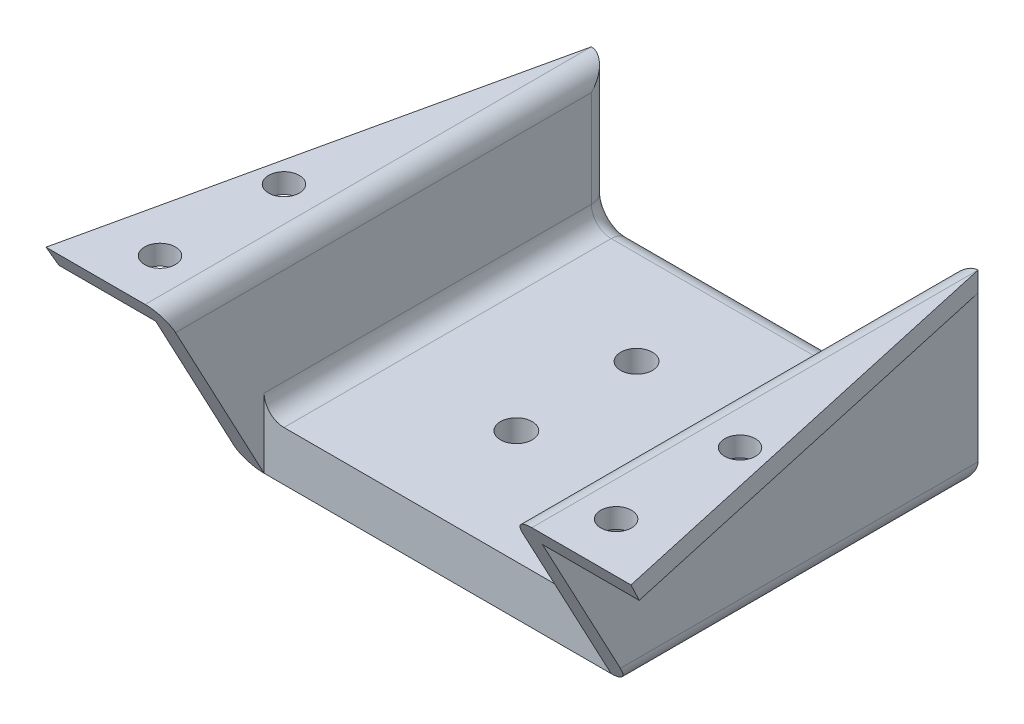
from build123d import *

# Parameters (mm, degrees)
SKETCH2_W           = 35
SKETCH2_H           = 35
SKETCH2_R           = 1.6
BOSS_EXTRUDE1_DEPTH = 5
BOSS_EXTRUDE2_DEPTH = 2
SKETCH4_R           = 1.55
BOSS_EXTRUDE3_DEPTH = 2
CUT_EXTRUDE1_DEPTH  = 52.27194652
FILLET1_R           = 2


with BuildPart() as part:
    # Sketch2 → Boss-Extrude1 (new body)
    with BuildSketch(Plane(origin=(0, 0, 0), x_dir=(1, 0, 0), z_dir=(0, 1, 0))):
        Rectangle(SKETCH2_W, SKETCH2_H)
        with Locations(Location((7, 0, 0), (0, 0, 270))):
            Circle(SKETCH2_R, mode=Mode.SUBTRACT)
        with Locations(Location((-3.5, -6.062177826, 0), (0, 0, 270))):
            Circle(SKETCH2_R, mode=Mode.SUBTRACT)
        with Locations(Location((-3.5, 6.062177826, 0), (0, 0, 270))):
            Circle(SKETCH2_R, mode=Mode.SUBTRACT)
    extrude(amount=BOSS_EXTRUDE1_DEPTH)

    # Sketch3 → Boss-Extrude2 (add)
    with BuildSketch(Plane(origin=(17.5, 0, 0), x_dir=(0, 0, -1), z_dir=(1, 0, 0))):
        Polygon((-17.5, 0), (-27.5, 18.75), (17.5, 18.75), (17.5, 0), align=None)
    boss_extrude2 = extrude(amount=BOSS_EXTRUDE2_DEPTH)

    # Mirror1: Boss-Extrude2 across plane
    add(boss_extrude2.mirror(Plane(origin=(0, 0, 0), x_dir=(0, 0, 1), z_dir=(1, 0, 0))))

    # Sketch4 → Boss-Extrude3 (add)
    with BuildSketch(Plane(origin=(0, 18.75, 0), x_dir=(1, 0, 0), z_dir=(0, 1, 0))):
        Polygon((-19.5, -27.5), (-29.5, -27.5), (-19.5, 17.5), align=None)
        with Locations(Location((-23, -22.5, 0), (0, 0, 270))):
            Circle(SKETCH4_R, mode=Mode.SUBTRACT)
        with Locations(Location((-23, -10, 0), (0, 0, 270))):
            Circle(SKETCH4_R, mode=Mode.SUBTRACT)
    boss_extrude3 = extrude(amount=-BOSS_EXTRUDE3_DEPTH)

    # Sketch5 → Cut-Extrude1 (cut, through all)
    with BuildSketch(Plane(origin=(-19.5, 0, 0), x_dir=(0, 0, -1), z_dir=(1, 0, 0))):
        Polygon((-27.5, 18.75), (-26.433333333, 16.75), (-27.5, 16.75), align=None)
    cut_extrude1 = extrude(amount=-CUT_EXTRUDE1_DEPTH, mode=Mode.SUBTRACT)

    # Mirror2: Boss-Extrude3, Cut-Extrude1 across plane
    add(boss_extrude3.mirror(Plane(origin=(0, 0, 0), x_dir=(0, 0, 1), z_dir=(1, 0, 0))))
    add(cut_extrude1.mirror(Plane(origin=(0, 0, 0), x_dir=(0, 0, 1), z_dir=(1, 0, 0))), mode=Mode.SUBTRACT)

    # Fillet1
    fillet1_edges = [part.edges().sort_by_distance(p)[0] for p in [
        (17.5, 11.875, -17.5),
        (-17.5, 11.875, -17.5),
        (-17.5, 18.75, 5),
        (17.5, 18.75, 5),
        (0, 5, -17.5),
        (0, 0, -17.5),
        (17.5, 5, 0),
        (-17.5, 5, 0),
        (-19.5, 0, 0),
        (19.5, 0, 0),
    ]]
    fillet(fillet1_edges, radius=FILLET1_R - 0.0001)  # a hair under: the kernel refuses the full size


solid = part.part
